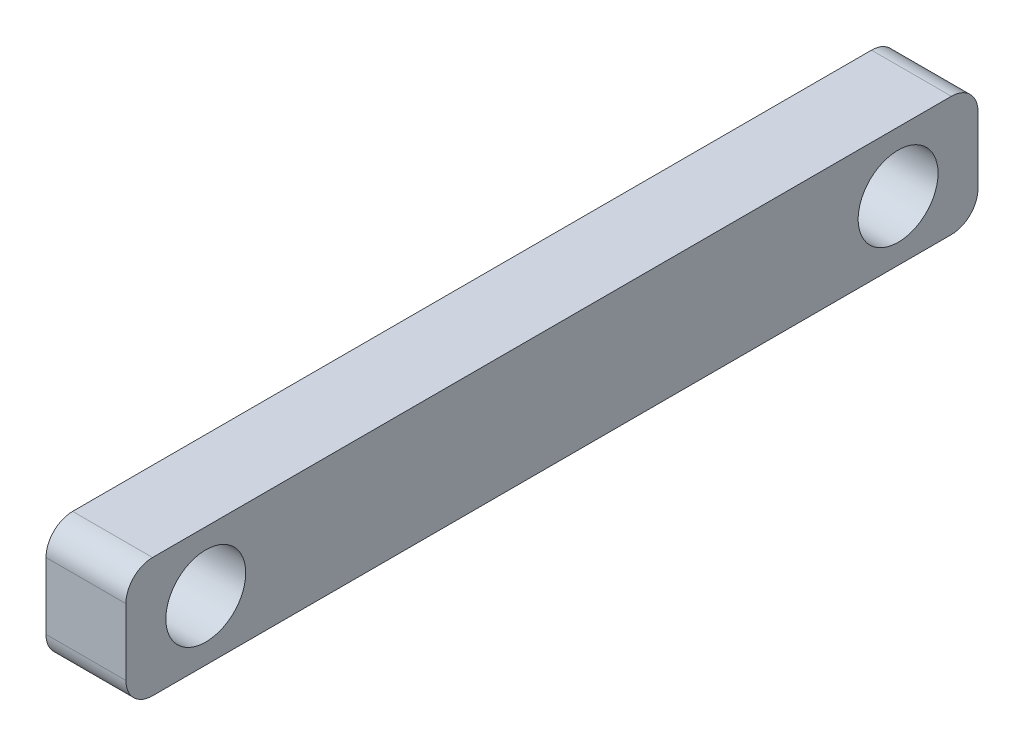
from build123d import *

# Parameters (mm, degrees)
SALIENTE_EXTRUIR1_DEPTH    = 1.5
CORTAR_EXTRUIR1_DEPTH      = 17.226906668
CORTAR_EXTRUIR1_DEPTH_BACK = 17.226906668
CROQUIS2_R                 = 1.5


with BuildPart() as part:
    # Croquis1 → Saliente-Extruir1 (new, symmetric)
    with BuildSketch(Plane(origin=(0, 0, 0), x_dir=(0, 0, -1), z_dir=(1, 0, 0))):
        with BuildLine():
            Line((-15, 2.25), (15, 2.25))
            ThreePointArc((15, 2.25), (15.707106781, 1.957106781), (16, 1.25))
            Line((16, 1.25), (16, -1.25))
            ThreePointArc((16, -1.25), (15.707106781, -1.957106781), (15, -2.25))
            Line((15, -2.25), (-15, -2.25))
            ThreePointArc((-15, -2.25), (-15.707106781, -1.957106781), (-16, -1.25))
            Line((-16, -1.25), (-16, 1.25))
            ThreePointArc((-16, 1.25), (-15.707106781, 1.957106781), (-15, 2.25))
        make_face()
    extrude(amount=SALIENTE_EXTRUIR1_DEPTH, both=True)

    # Croquis2 → Cortar-Extruir1 (cut, two sides: drawn at the far end of the back side and taken through both)
    with BuildSketch(Plane(origin=(0, 0, 0), x_dir=(0, 0, -1), z_dir=(1, 0, 0)).offset(-CORTAR_EXTRUIR1_DEPTH_BACK)):
        with Locations((-13, 0)):
            Circle(CROQUIS2_R)
        with Locations((13, 0)):
            Circle(CROQUIS2_R)
    extrude(amount=CORTAR_EXTRUIR1_DEPTH + CORTAR_EXTRUIR1_DEPTH_BACK, mode=Mode.SUBTRACT)


solid = part.part
